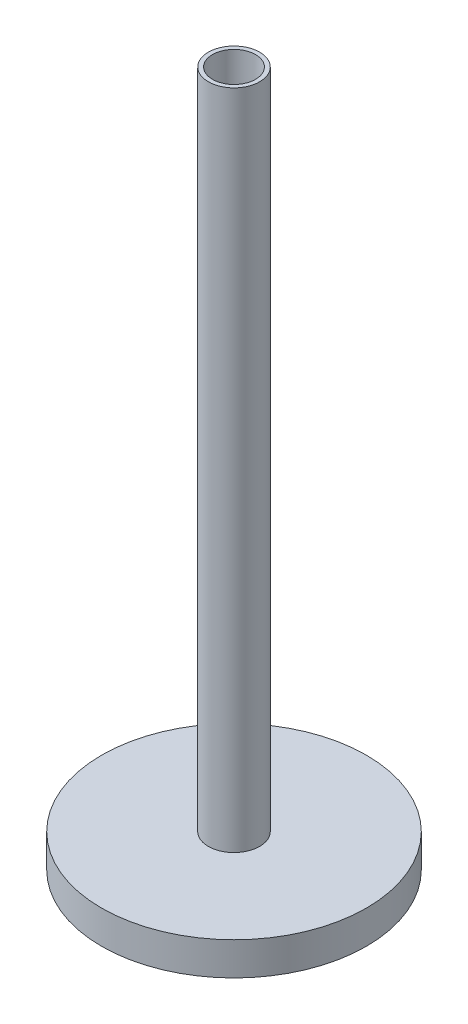
from build123d import *

# Parameters (mm, degrees)
SKETCH1_R           = 7.75
SKETCH1_R_2         = 6.5
BOSS_EXTRUDE1_DEPTH = 200
BOSS_EXTRUDE2_START = 10
SKETCH2_R           = 40.000518223
SKETCH2_R_2         = 7.75
BOSS_EXTRUDE2_DEPTH = 10
BOSS_EXTRUDE3_START = -20.476429663
SKETCH1_2_R         = 7.75
SKETCH1_2_R_2       = 6.5
BOSS_EXTRUDE3_DEPTH = 20.476429663


with BuildPart() as part:
    # Sketch1 → Boss-Extrude1 (new body)
    with BuildSketch(Plane(origin=(0, 0, 0), x_dir=(1, 0, 0), z_dir=(0, 1, 0))):
        Circle(SKETCH1_R)
        Circle(SKETCH1_R_2, mode=Mode.SUBTRACT)
    extrude(amount=BOSS_EXTRUDE1_DEPTH)

    # Sketch1<2> → Boss-Extrude3 (add)
    with BuildSketch(Plane(origin=(0, 0, 0), x_dir=(1, 0, 0), z_dir=(0, 1, 0)).offset(BOSS_EXTRUDE3_START)):
        Circle(SKETCH1_2_R)
        Circle(SKETCH1_2_R_2, mode=Mode.SUBTRACT)
    extrude(amount=BOSS_EXTRUDE3_DEPTH)


with BuildPart() as body_2:
    # Sketch2 → Boss-Extrude2 (new body)
    with BuildSketch(Plane(origin=(0, 0, 0), x_dir=(-1, 0, 0), z_dir=(0, -1, 0)).offset(BOSS_EXTRUDE2_START)):
        Circle(SKETCH2_R)
        Circle(SKETCH2_R_2, mode=Mode.SUBTRACT)
    extrude(amount=-BOSS_EXTRUDE2_DEPTH)


solid = Compound([part.part, body_2.part])
